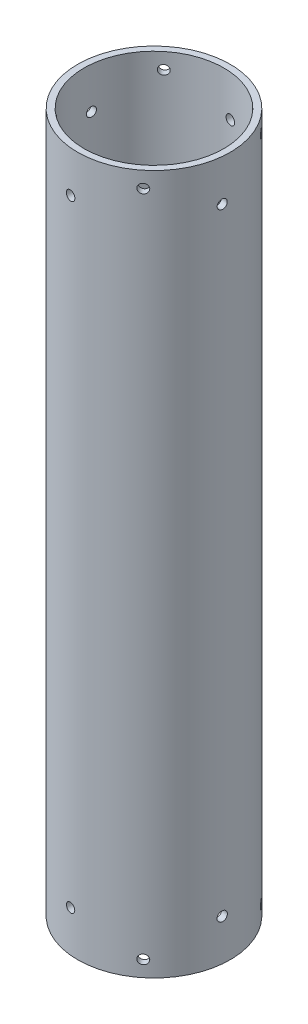
from build123d import *

# Parameters (mm, degrees)
SKETCH_1_R               = 24
SKETCH_1_R_2             = 22
EXTRUDE_1_DEPTH          = 220
CUT_EXTRUDE_1_DEPTH      = 226.837302568
CUT_EXTRUDE_1_DEPTH_BACK = 226.837302568
SKETCH_2_R               = 1.45
SKETCH_2_R_2             = 1.5
CUT_EXTRUDE_2_DEPTH      = 227.501545285
CUT_EXTRUDE_2_DEPTH_BACK = 227.501545285
SKETCH_3_R               = 1.45
CUT_EXTRUDE_3_DEPTH      = 227.501545285
CUT_EXTRUDE_3_DEPTH_BACK = 227.501545285
SKETCH_5_R               = 1.45
CUT_EXTRUDE_4_DEPTH      = 226.837302696
CUT_EXTRUDE_4_DEPTH_BACK = 226.837302696
SKETCH_4_R               = 1.5
SKETCH_4_R_2             = 1.45


with BuildPart() as part:
    # 草图1 → 凸台-拉伸1 (new body)
    with BuildSketch(Plane(origin=(0, 0, 0), x_dir=(1, 0, 0), z_dir=(0, 1, 0))):
        Circle(SKETCH_1_R)
        Circle(SKETCH_1_R_2, mode=Mode.SUBTRACT)
    extrude(amount=EXTRUDE_1_DEPTH)

    # 草图2 → 切除-拉伸1 (cut, two sides: drawn at the far end of the back side and taken through both)
    with BuildSketch(Plane(origin=(-1.983778232, 0, 19.901372413), x_dir=(-0.9950686206551753, 0, -0.09918891161519433), z_dir=(0.09918891161519434, 0, -0.9950686206551754)).offset(-CUT_EXTRUDE_1_DEPTH_BACK)):
        with Locations((0, 13)):
            Circle(SKETCH_2_R)
        with Locations((0, 207)):
            Circle(SKETCH_2_R_2)
    extrude(amount=CUT_EXTRUDE_1_DEPTH + CUT_EXTRUDE_1_DEPTH_BACK, mode=Mode.SUBTRACT)

    # 草图3 → 切除-拉伸2 (cut, two sides: drawn at the far end of the back side and taken through both)
    with BuildSketch(Plane(origin=(12.669652348, 0, 15.475138429), x_dir=(-0.7737569214328358, 0, 0.6334826173896017), z_dir=(-0.6334826173896017, 0, -0.7737569214328358)).offset(-CUT_EXTRUDE_2_DEPTH_BACK)):
        with Locations((0, 5)):
            Circle(SKETCH_3_R)
        with Locations((0, 215)):
            Circle(SKETCH_3_R)
    extrude(amount=CUT_EXTRUDE_2_DEPTH + CUT_EXTRUDE_2_DEPTH_BACK, mode=Mode.SUBTRACT)

    # 草图5 → 切除-拉伸3 (cut, two sides: drawn at the far end of the back side and taken through both)
    with BuildSketch(Plane(origin=(15.475138429, 0, -12.669652348), x_dir=(0.6334826173896017, 1.101974499629939e-15, 0.7737569214328358), z_dir=(-0.7737569214328358, -1.3459886237205982e-15, 0.6334826173896017)).offset(-CUT_EXTRUDE_3_DEPTH_BACK)):
        with Locations((0, 5)):
            Circle(SKETCH_5_R)
        with Locations((0, 215)):
            Circle(SKETCH_5_R)
    extrude(amount=CUT_EXTRUDE_3_DEPTH + CUT_EXTRUDE_3_DEPTH_BACK, mode=Mode.SUBTRACT)

    # 草图4 → 切除-拉伸4 (cut, two sides: drawn at the far end of the back side and taken through both)
    with BuildSketch(Plane(origin=(19.901372413, 0, 1.983778232), x_dir=(-0.0991889116151947, 0, 0.9950686206551753), z_dir=(-0.9950686206551752, -1.0302623061669713e-15, -0.09918891161519469)).offset(-CUT_EXTRUDE_4_DEPTH_BACK)):
        with Locations((0, 13)):
            Circle(SKETCH_4_R)
        with Locations((0, 207)):
            Circle(SKETCH_4_R_2)
    extrude(amount=CUT_EXTRUDE_4_DEPTH + CUT_EXTRUDE_4_DEPTH_BACK, mode=Mode.SUBTRACT)


solid = part.part
